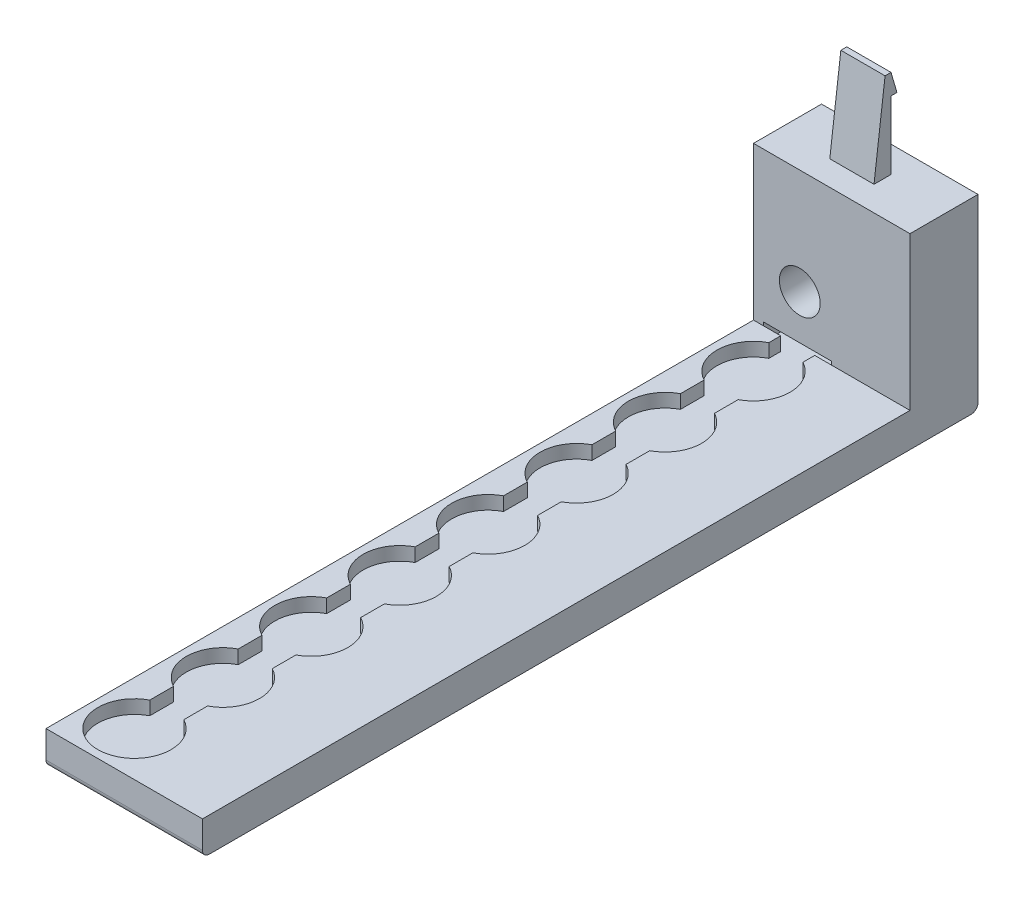
from build123d import *

# Parameters (mm, degrees)
SKETCH5_W           = 26
SKETCH5_H           = 26
BOSS_EXTRUDE1_DEPTH = 10
SKETCH4_R           = 10.75
CUT_EXTRUDE1_DEPTH  = 4
SKETCH6_W           = 10
SKETCH6_H           = 3.483566845
CUT_EXTRUDE2_DEPTH  = 4
LPATTERN1_COUNT     = 8
LPATTERN1_PITCH     = 26
SKETCH7_W           = 10
SKETCH7_H           = 4
CUT_EXTRUDE3_DEPTH  = 183.737516674
SKETCH12_W          = 208
SKETCH12_H          = 10
BOSS_EXTRUDE3_DEPTH = 20
SKETCH14_W          = 46
SKETCH14_H          = 10
BOSS_EXTRUDE4_DEPTH = 20
SKETCH15_W          = 46
SKETCH15_H          = 20
BOSS_EXTRUDE5_DEPTH = 45
SKETCH16_W          = 20
SKETCH16_H          = 5
CUT_EXTRUDE5_DEPTH  = 20
SKETCH17_R          = 6
CUT_EXTRUDE6_DEPTH  = 45
SKETCH18_W          = 6
SKETCH18_H          = 19
CUT_EXTRUDE7_DEPTH  = 20
SNAP_START          = 2.145910006
SNAP_HOOK1_DEPTH    = 13
FILLET2_R           = 2


# Read off the part's stored shape, not the designer's step: Snap Hook1
with BuildPart() as part:
    # Sketch5 → Boss-Extrude1 (new body)
    with BuildSketch(Plane(origin=(0, 0, 0), x_dir=(1, 0, 0), z_dir=(0, 1, 0))):
        Rectangle(SKETCH5_W, SKETCH5_H)
    boss_extrude1 = extrude(amount=-BOSS_EXTRUDE1_DEPTH)

    # Sketch4 → Cut-Extrude1 (cut)
    with BuildSketch(Plane(origin=(0, 0, 0), x_dir=(1, 0, 0), z_dir=(0, 1, 0))):
        with Locations(Location((0, 0, 0), (0, 0, 270))):
            Circle(SKETCH4_R)
    cut_extrude1 = extrude(amount=-CUT_EXTRUDE1_DEPTH, mode=Mode.SUBTRACT)

    # Sketch6 → Cut-Extrude2 (cut)
    with BuildSketch(Plane(origin=(0, 0, 0), x_dir=(1, 0, 0), z_dir=(0, 1, 0))):
        with Locations((0, 11.258216578)):
            Rectangle(SKETCH6_W, SKETCH6_H)
    cut_extrude2 = extrude(amount=-CUT_EXTRUDE2_DEPTH, mode=Mode.SUBTRACT)

    # LPattern1: Boss-Extrude1, Cut-Extrude1, Cut-Extrude2 ×8
    with Locations(*[(0, 0, -i * LPATTERN1_PITCH) for i in range(1, LPATTERN1_COUNT)]):
        add(boss_extrude1)
        add(cut_extrude1, mode=Mode.SUBTRACT)
        add(cut_extrude2, mode=Mode.SUBTRACT)

    # Sketch7 → Cut-Extrude3 (cut, through all)
    with BuildSketch(Plane.XY.offset(-13)):
        with Locations((0, -2)):
            Rectangle(SKETCH7_W, SKETCH7_H)
    extrude(amount=-CUT_EXTRUDE3_DEPTH, mode=Mode.SUBTRACT)

    # Sketch12 → Boss-Extrude3 (add)
    with BuildSketch(Plane(origin=(13, 0, 0), x_dir=(0, 0, -1), z_dir=(1, 0, 0))):
        with Locations((91, -5)):
            Rectangle(SKETCH12_W, SKETCH12_H)
    extrude(amount=BOSS_EXTRUDE3_DEPTH)

    # Sketch14 → Boss-Extrude4 (add)
    with BuildSketch(Plane(origin=(0, 0, -195), x_dir=(-1, 0, 0), z_dir=(0, 0, -1))):
        with Locations((-10, -5)):
            Rectangle(SKETCH14_W, SKETCH14_H)
    extrude(amount=BOSS_EXTRUDE4_DEPTH)

    # Sketch15 → Boss-Extrude5 (add)
    with BuildSketch(Plane(origin=(0, 0, 0), x_dir=(1, 0, 0), z_dir=(0, 1, 0))):
        with Locations((10, 205)):
            Rectangle(SKETCH15_W, SKETCH15_H)
    extrude(amount=BOSS_EXTRUDE5_DEPTH)

    # Sketch16 → Cut-Extrude5 (cut)
    with BuildSketch(Plane(origin=(0, 0, -215), x_dir=(-1, 0, 0), z_dir=(0, 0, -1))):
        with Locations((0, -1.5)):
            Rectangle(SKETCH16_W, SKETCH16_H)
    extrude(amount=-CUT_EXTRUDE5_DEPTH, mode=Mode.SUBTRACT)

    # Sketch17 → Cut-Extrude6 (cut)
    with BuildSketch(Plane(origin=(0, 0, -215), x_dir=(-1, 0, 0), z_dir=(0, 0, -1))):
        with Locations((-0.602201255, 14)):
            Circle(SKETCH17_R)
    extrude(amount=-CUT_EXTRUDE6_DEPTH, mode=Mode.SUBTRACT)

    # Sketch18 → Cut-Extrude7 (cut)
    with BuildSketch(Plane.ZY.offset(13)):
        with Locations((-207, 13.5)):
            Rectangle(SKETCH18_W, SKETCH18_H)
    extrude(amount=-CUT_EXTRUDE7_DEPTH, mode=Mode.SUBTRACT)

    # Snap Hook1 outline → Snap Hook1 (add)
    with BuildSketch(Plane.YZ.offset(SNAP_START)):
        Polygon((45, -207.281762619), (65, -207.281762619), (65, -209.025762619), (71, -207.281762619), (71, -205.531762619), (45, -202.281762619), align=None)
    extrude(amount=SNAP_HOOK1_DEPTH)

    # Fillet2
    fillet2_edges = [part.edges().sort_by_distance(p)[0] for p in [
        (10, -10, -215),
        (10, -10, 13),
    ]]
    fillet(fillet2_edges, radius=FILLET2_R)


solid = part.part
